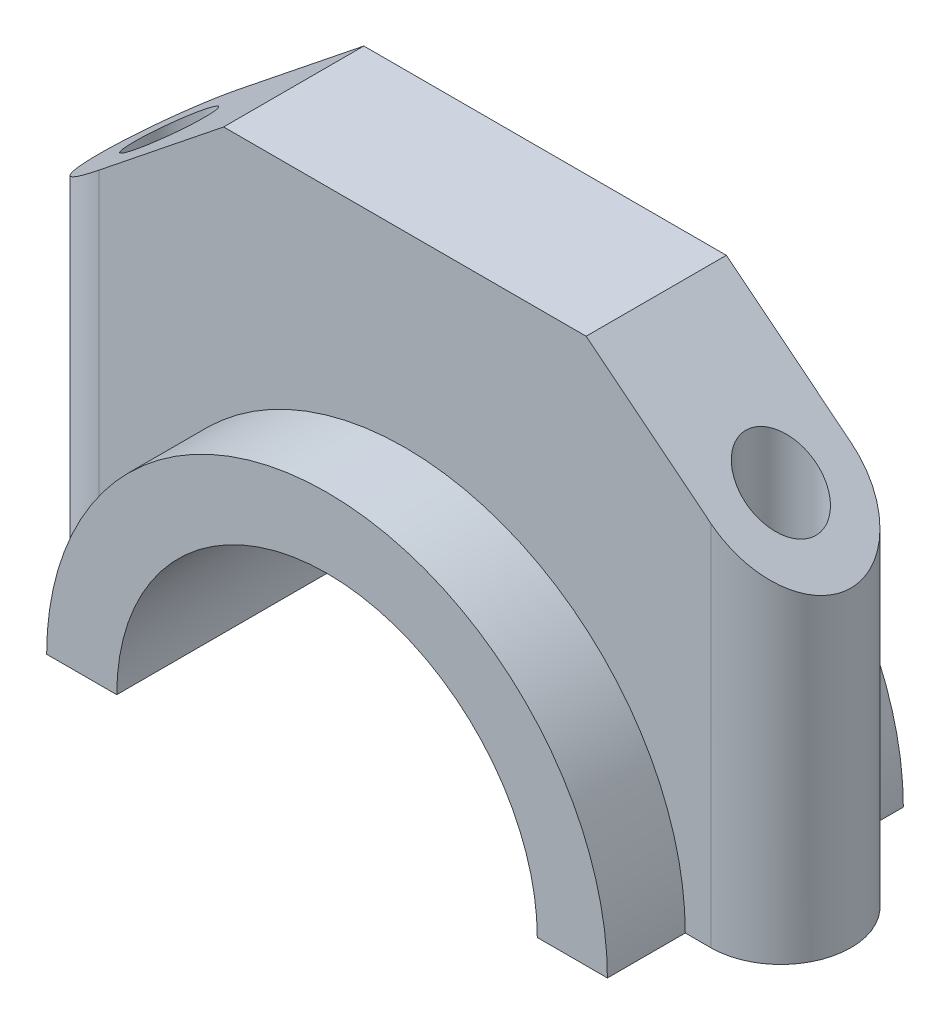
from build123d import *
from build123d.topology import SkipClean

# Parameters (mm, degrees)
BOSS_EXTRUDE1_DEPTH = 38
BOSS_EXTRUDE2_REACH = 81.624
CUT_EXTRUDE1_START  = -38
SKETCH3_R           = 27
CUT_EXTRUDE1_DEPTH  = 38
SKETCH4_R           = 4.5
CUT_EXTRUDE2_DEPTH  = 64
CUT_EXTRUDE3_DEPTH  = 64


with BuildPart() as part:
    # Sketch1 → Boss-Extrude1 (new body)
    with BuildSketch(Plane.XY):
        with BuildLine():
            ThreePointArc((36, 0), (0, 36), (-36, 0))
            Line((-36, 0), (-27, 0))
            ThreePointArc((-27, 0), (0, 27), (27, 0))
            Line((27, 0), (36, 0))
        make_face()
    extrude(amount=BOSS_EXTRUDE1_DEPTH)

    # Boss-Extrude2: up to this face of the body (flat: up to its plane)
    boss_extrude2_end = Plane(part.part.faces().sort_by_distance((31.5, 0, 19))[0])
    # Sketch2 → Boss-Extrude2 (add, up to the picked face)
    with BuildSketch(Plane(origin=(0, 60, 0), x_dir=(-1, 0, 0), z_dir=(0, -1, 0)), mode=Mode.PRIVATE) as boss_extrude2_sk1:
        with BuildLine():
            Line((-39.272787465, -10), (39.272787465, -10))
            ThreePointArc((39.272787465, -10), (48.272787465, -19), (39.272787465, -28))
            Line((39.272787465, -28), (-39.272787465, -28))
            ThreePointArc((-39.272787465, -28), (-48.272787465, -19), (-39.272787465, -10))
        make_face()
    boss_extrude2_tool1 = split(extrude(boss_extrude2_sk1.sketch, amount=BOSS_EXTRUDE2_REACH, mode=Mode.PRIVATE), bisect_by=boss_extrude2_end, keep=Keep.BOTH, mode=Mode.PRIVATE)
    add(boss_extrude2_tool1.solids().sort_by(Axis((0, 60, 19), (0, -1, 0)))[0])

    # Sketch3 → Cut-Extrude1 (cut)
    with SkipClean():  # the faces are left unmerged after this step: merging them gives an invalid solid
        with BuildSketch(Plane.XY.offset(28).offset(CUT_EXTRUDE1_START)):
            Circle(SKETCH3_R)
        extrude(amount=CUT_EXTRUDE1_DEPTH, mode=Mode.SUBTRACT)
    add(part.part.scale(1), mode=Mode.REPLACE)  # the faces are merged on a copy

    # Sketch4 → Cut-Extrude2 (cut)
    with BuildSketch(Plane(origin=(0, 60, 0), x_dir=(1, 0, 0), z_dir=(0, 1, 0))):
        with Locations(Location((-39.272787465, -19, 0), (0, 0, 270))):
            Circle(SKETCH4_R)
    cut_extrude2 = extrude(amount=-CUT_EXTRUDE2_DEPTH, mode=Mode.SUBTRACT)

    # Mirror1: Cut-Extrude2 across plane
    add(cut_extrude2.mirror(Plane(origin=(0, 0, 0), x_dir=(0, 0, 1), z_dir=(1, 0, 0))), mode=Mode.SUBTRACT)

    # Sketch6 → Cut-Extrude3 (cut)
    with BuildSketch(Plane.XY.offset(28)):
        Polygon((-48.272787465, 40), (-39.272787465, 47.2), (-39.272787465, 60), (-48.272787465, 60), align=None)
        Polygon((-39.272787465, 47.2), (-23.272787465, 60), (-39.272787465, 60), align=None)
    cut_extrude3 = extrude(amount=-CUT_EXTRUDE3_DEPTH, mode=Mode.SUBTRACT)

    # Mirror2: Cut-Extrude3 across plane
    add(cut_extrude3.mirror(Plane(origin=(0, 0, 0), x_dir=(0, 0, 1), z_dir=(1, 0, 0))), mode=Mode.SUBTRACT)


solid = part.part
